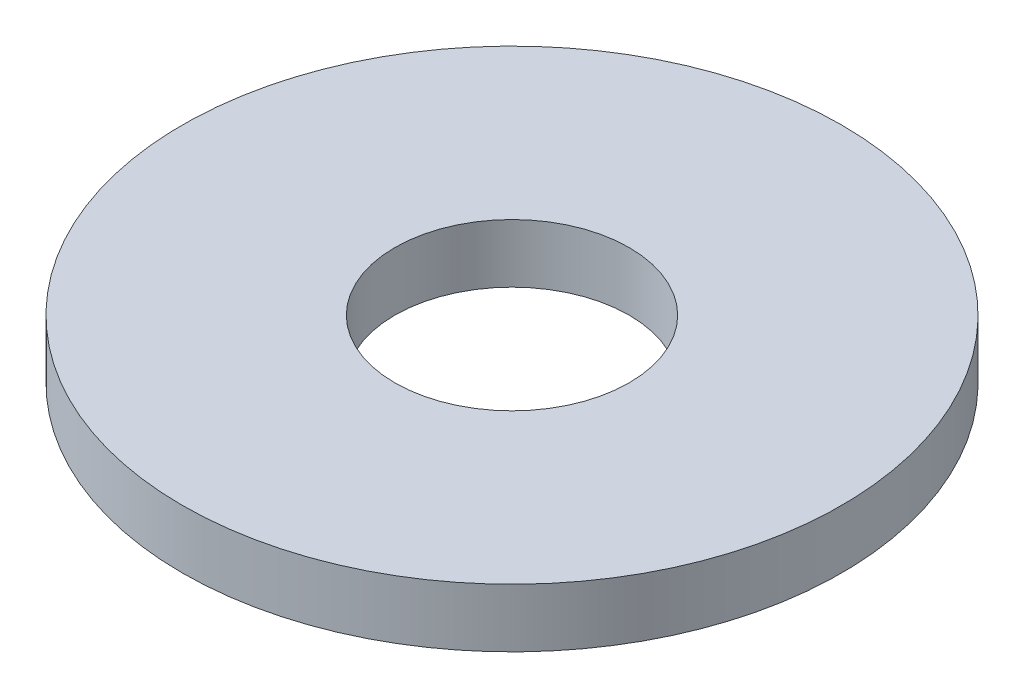
from build123d import *

# Parameters (mm, degrees)
SKETCH1_R           = 4.5
SKETCH1_R_2         = 1.6
BOSS_EXTRUDE1_DEPTH = 0.8


with BuildPart() as part:
    # Sketch1 → Boss-Extrude1 (new body)
    with BuildSketch(Plane(origin=(0, 0, 0), x_dir=(1, 0, 0), z_dir=(0, 1, 0))):
        Circle(SKETCH1_R)
        Circle(SKETCH1_R_2, mode=Mode.SUBTRACT)
    extrude(amount=BOSS_EXTRUDE1_DEPTH)


solid = part.part
